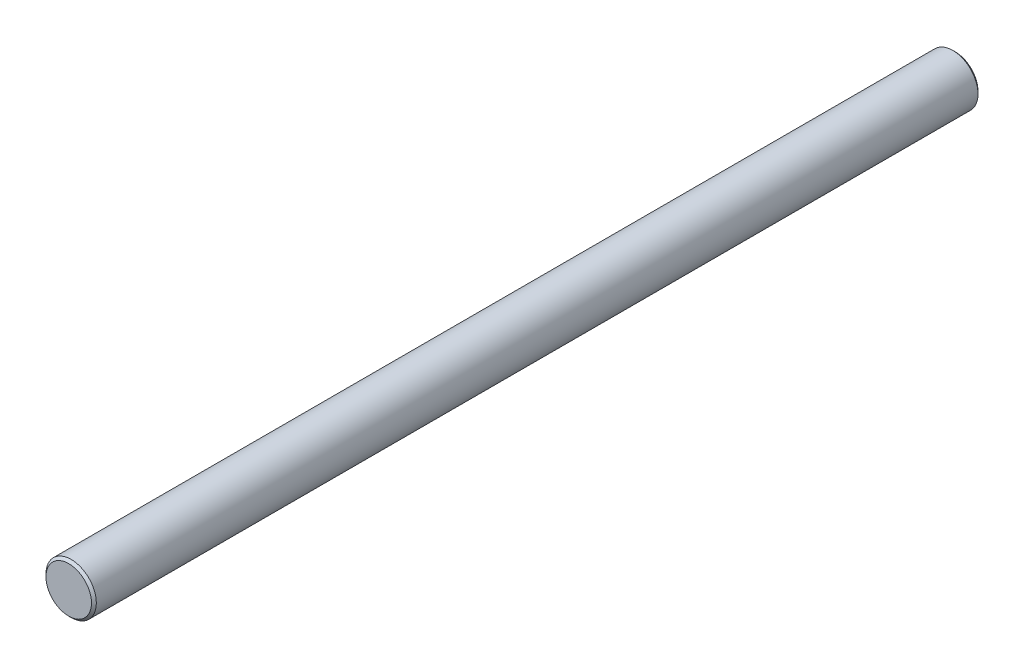
from build123d import *

# Parameters (mm, degrees)
SKETCH1_R           = 7.9375
BOSS_EXTRUDE1_DEPTH = 139.7
CHAMFER1_SIZE       = 0.762


with BuildPart() as part:
    # Sketch1 → Boss-Extrude1 (new, symmetric)
    with BuildSketch(Plane.XY):
        Circle(SKETCH1_R)
    extrude(amount=BOSS_EXTRUDE1_DEPTH, both=True)

    # Chamfer1
    chamfer1_edges = [part.edges().sort_by_distance(p)[0] for p in [
        (-7.9375, 0, -139.7),
        (-7.9375, 0, 139.7),
    ]]
    chamfer(chamfer1_edges, length=CHAMFER1_SIZE)


solid = part.part
